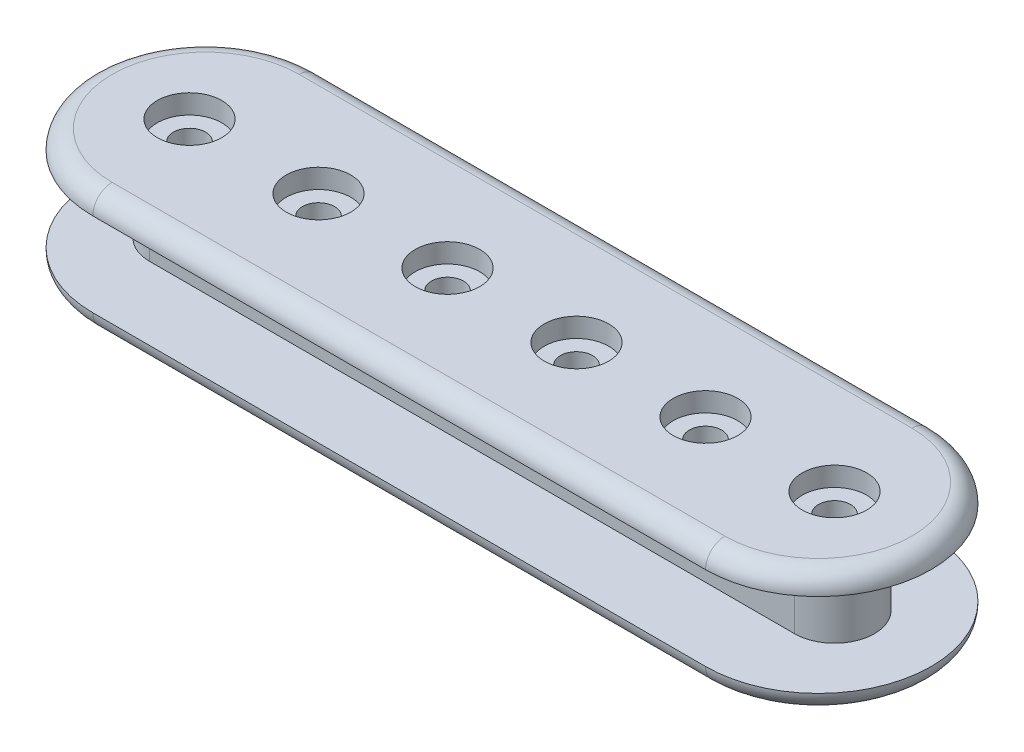
from build123d import *
from build123d.topology import SkipClean

# Parameters (mm, degrees)
BOSS_EXTRUDE1_DEPTH     = 1.524
SKETCH2_R               = 1.2700000000000011
BOSS_EXTRUDE2_DEPTH     = 6.603999999999999
BOSS_EXTRUDE3_DEPTH     = 1.524
FILLET1_R               = 1.524
CUT_EXTRUDE1_DEPTH      = 36.14849760658342
CUT_EXTRUDE1_DEPTH_BACK = 36.14849760658342
SKETCH2_3_R             = 1.2700000000000011
CUT_EXTRUDE2_DEPTH      = 36.53186744318402
CUT_EXTRUDE2_DEPTH_BACK = 1.524
SKETCH4_R               = 2.539999999999999


with BuildPart() as part:
    # Sketch1 → Boss-Extrude1 (new body)
    with BuildSketch(Plane(origin=(0, 0, 0), x_dir=(1, 0, 0), z_dir=(0, 1, 0))):
        with BuildLine():
            Line((24.13, -8.88999999999999), (-24.13, -8.889999999999995))
            ThreePointArc((-24.13, -8.889999999999995), (-33.019999999999996, 2.78e-15), (-24.130000000000003, 8.89))
            Line((-24.130000000000003, 8.89), (24.130000000000003, 8.890000000000006))
            ThreePointArc((24.130000000000003, 8.890000000000006), (33.02, 8.03e-15), (24.13, -8.88999999999999))
        make_face()
    extrude(amount=BOSS_EXTRUDE1_DEPTH)

    # Sketch2 → Boss-Extrude2 (add)
    # profile 1 of 35: a face of its own
    with BuildSketch(Plane(origin=(0, 1.524, 0), x_dir=(1, 0, 0), z_dir=(0, 1, 0))):
        with BuildLine():
            ThreePointArc((-22.64366109485788, 1.5239999999999858), (-23.80000160000079, 2.7129292803167524), (-25.399999999999995, 3.1495999999999986))
            ThreePointArc((-25.399999999999995, 3.1495999999999986), (-28.549599999999995, 3.9e-16), (-25.399999999999995, -3.1495999999999986))
            ThreePointArc((-25.399999999999995, -3.1495999999999986), (-23.80000160000079, -2.7129292803167524), (-22.64366109485788, -1.5239999999999856))
            Line((-22.643661094857876, -1.5239999999999954), (-25.4, -1.5239999999999954))
            Line((-25.4, -1.5239999999999954), (-25.4, -1.2700000000000011))
            ThreePointArc((-25.40000000000001, -1.2700000000000011), (-26.669999999999995, -9.7e-16), (-25.400000000000013, 1.2700000000000011))
            Line((-25.4, 1.2700000000000011), (-25.4, 1.5239999999999954))
            Line((-25.4, 1.5239999999999954), (-22.643661094857876, 1.5239999999999954))
        make_face()
    # profile 2 of 35: a face of its own
    with BuildSketch(Plane(origin=(0, 1.524, 0), x_dir=(1, 0, 0), z_dir=(0, 1, 0))):
        with BuildLine():
            ThreePointArc((-22.250399999999996, 0), (-22.350299590481413, 0.7869609724644511), (-22.64366109485788, 1.5239999999999858))
            Line((-22.643661094857876, 1.5239999999999954), (-25.4, 1.5239999999999954))
            Line((-25.4, 1.5239999999999954), (-25.4, 1.2700000000000011))
            ThreePointArc((-25.400000000000013, 1.2700000000000011), (-24.501974387893085, 0.8980256121069224), (-24.129999999999995, 0))
            ThreePointArc((-24.129999999999995, -3.1e-16), (-24.501974387893085, -0.898025612106922), (-25.40000000000001, -1.2700000000000011))
            Line((-25.4, -1.2700000000000011), (-25.4, -1.5239999999999954))
            Line((-25.4, -1.5239999999999954), (-22.643661094857876, -1.5239999999999954))
            ThreePointArc((-22.64366109485788, -1.5239999999999856), (-22.350299590481413, -0.7869609724644512), (-22.250399999999996, -7.7e-16))
        make_face()
    # profile 3 of 35: a face of its own
    with BuildSketch(Plane(origin=(0, 1.524, 0), x_dir=(1, 0, 0), z_dir=(0, 1, 0))):
        with BuildLine():
            Line((-15.239999999999851, 3.149599999999998), (-25.399999999999995, 3.149599999999998))
            ThreePointArc((-25.399999999999995, 3.1495999999999986), (-23.80000160000079, 2.7129292803167524), (-22.64366109485788, 1.5239999999999858))
            Line((-22.643661094857876, 1.5239999999999954), (-17.99633890514213, 1.5239999999999954))
            ThreePointArc((-17.99633890514212, 1.5239999999999714), (-16.839998399999146, 2.712929280316786), (-15.239999999999851, 3.1496000000000004))
        make_face()
    # profile 4 of 35: a face of its own
    with BuildSketch(Plane(origin=(0, 1.524, 0), x_dir=(1, 0, 0), z_dir=(0, 1, 0))):
        with BuildLine():
            Line((-17.99633890514213, 1.5239999999999954), (-22.643661094857876, 1.5239999999999954))
            ThreePointArc((-22.64366109485788, 1.5239999999999858), (-22.350299590481413, 0.7869609724644511), (-22.250399999999996, 0))
            ThreePointArc((-22.250399999999996, -7.7e-16), (-22.350299590481413, -0.7869609724644512), (-22.64366109485788, -1.5239999999999856))
            Line((-22.643661094857876, -1.5239999999999954), (-17.99633890514213, -1.5239999999999954))
            ThreePointArc((-17.99633890514212, -1.5239999999999694), (-18.389599999999994, 3.9e-16), (-17.99633890514212, 1.5239999999999714))
        make_face()
    # profile 5 of 35: a face of its own
    with BuildSketch(Plane(origin=(0, 1.524, 0), x_dir=(1, 0, 0), z_dir=(0, 1, 0))):
        with BuildLine():
            ThreePointArc((-22.64366109485788, 1.5239999999999858), (-23.80000160000079, 2.7129292803167524), (-25.399999999999995, 3.1495999999999986))
            ThreePointArc((-25.399999999999995, 3.1495999999999986), (-28.549599999999995, 3.9e-16), (-25.399999999999995, -3.1495999999999986))
            ThreePointArc((-25.399999999999995, -3.1495999999999986), (-23.80000160000079, -2.7129292803167524), (-22.64366109485788, -1.5239999999999856))
            Line((-22.643661094857876, -1.5239999999999954), (-25.4, -1.5239999999999954))
            Line((-25.4, -1.5239999999999954), (-25.4, -1.2700000000000011))
            ThreePointArc((-25.40000000000001, -1.2700000000000011), (-26.669999999999995, -9.7e-16), (-25.400000000000013, 1.2700000000000011))
            Line((-25.4, 1.2700000000000011), (-25.4, 1.5239999999999954))
            Line((-25.4, 1.5239999999999954), (-22.643661094857876, 1.5239999999999954))
        make_face()
    # profile 6 of 35: a face of its own
    with BuildSketch(Plane(origin=(0, 1.524, 0), x_dir=(1, 0, 0), z_dir=(0, 1, 0))):
        with BuildLine():
            ThreePointArc((-22.250399999999996, 0), (-22.350299590481413, 0.7869609724644511), (-22.64366109485788, 1.5239999999999858))
            Line((-22.643661094857876, 1.5239999999999954), (-25.4, 1.5239999999999954))
            Line((-25.4, 1.5239999999999954), (-25.4, 1.2700000000000011))
            ThreePointArc((-25.400000000000013, 1.2700000000000011), (-24.501974387893085, 0.8980256121069224), (-24.129999999999995, 0))
            ThreePointArc((-24.129999999999995, -3.1e-16), (-24.501974387893085, -0.898025612106922), (-25.40000000000001, -1.2700000000000011))
            Line((-25.4, -1.2700000000000011), (-25.4, -1.5239999999999954))
            Line((-25.4, -1.5239999999999954), (-22.643661094857876, -1.5239999999999954))
            ThreePointArc((-22.64366109485788, -1.5239999999999856), (-22.350299590481413, -0.7869609724644512), (-22.250399999999996, -7.7e-16))
        make_face()
    # profile 7 of 35: a face of its own
    with BuildSketch(Plane(origin=(0, 1.524, 0), x_dir=(1, 0, 0), z_dir=(0, 1, 0))):
        with BuildLine():
            ThreePointArc((-22.64366109485788, -1.5239999999999856), (-23.80000160000079, -2.7129292803167524), (-25.399999999999995, -3.1495999999999986))
            Line((-25.399999999999995, -3.149599999999998), (-15.239999999999842, -3.149599999999998))
            ThreePointArc((-15.239999999999844, -3.1496000000000004), (-16.839998399999146, -2.7129292803167875), (-17.99633890514212, -1.5239999999999694))
            Line((-17.99633890514213, -1.5239999999999954), (-22.643661094857876, -1.5239999999999954))
        make_face()
    # profile 8 of 35: a face of its own
    with BuildSketch(Plane(origin=(0, 1.524, 0), x_dir=(1, 0, 0), z_dir=(0, 1, 0))):
        with BuildLine():
            ThreePointArc((-17.99633890514212, -1.5239999999999694), (-16.839998399999146, -2.7129292803167875), (-15.239999999999844, -3.1496000000000004))
            ThreePointArc((-15.239999999999844, -3.1496000000000004), (-13.640001600000728, -2.7129292803167186), (-12.483661094857885, -1.5239999999999987))
            Line((-12.483661094857887, -1.5239999999999954), (-17.99633890514213, -1.5239999999999954))
        make_face()
    # profile 9 of 35: a face of its own
    with BuildSketch(Plane(origin=(0, 1.524, 0), x_dir=(1, 0, 0), z_dir=(0, 1, 0))):
        with BuildLine():
            ThreePointArc((-12.090399999999995, 0), (-12.190299590481414, 0.7869609724644582), (-12.483661094857885, 1.523999999999999))
            Line((-12.483661094857887, 1.5239999999999954), (-17.99633890514213, 1.5239999999999954))
            ThreePointArc((-17.99633890514212, 1.5239999999999714), (-18.389599999999994, 3.9e-16), (-17.99633890514212, -1.5239999999999694))
            Line((-17.99633890514213, -1.5239999999999954), (-12.483661094857887, -1.5239999999999954))
            ThreePointArc((-12.483661094857885, -1.5239999999999987), (-12.190299590481414, -0.7869609724644571), (-12.090399999999995, -7.7e-16))
        make_face()
        with Locations(Location((-15.239999999999995, 0, 0), (0, 0, 90))):
            Circle(SKETCH2_R, mode=Mode.SUBTRACT)
    # profile 10 of 35: a face of its own
    with BuildSketch(Plane(origin=(0, 1.524, 0), x_dir=(1, 0, 0), z_dir=(0, 1, 0))):
        with BuildLine():
            ThreePointArc((-12.483661094857885, 1.523999999999999), (-13.640001600000732, 2.712929280316721), (-15.239999999999853, 3.1496000000000004))
            ThreePointArc((-15.239999999999851, 3.1496000000000004), (-16.839998399999146, 2.712929280316786), (-17.99633890514212, 1.5239999999999714))
            Line((-17.99633890514213, 1.5239999999999954), (-12.483661094857887, 1.5239999999999954))
        make_face()
    # profile 11 of 35: a face of its own
    with BuildSketch(Plane(origin=(0, 1.524, 0), x_dir=(1, 0, 0), z_dir=(0, 1, 0))):
        with BuildLine():
            Line((-5.080000024231023, 3.149599999999998), (-15.239999999999851, 3.149599999999998))
            ThreePointArc((-15.239999999999853, 3.1496000000000004), (-13.640001600000732, 2.712929280316721), (-12.483661094857885, 1.523999999999999))
            Line((-12.483661094857887, 1.5239999999999954), (-7.836338905142128, 1.5239999999999954))
            ThreePointArc((-7.836338905142118, 1.5239999999999725), (-6.679998410434988, 2.712929274162062), (-5.0800000242310235, 3.1496))
        make_face()
    # profile 12 of 35: a face of its own
    with BuildSketch(Plane(origin=(0, 1.524, 0), x_dir=(1, 0, 0), z_dir=(0, 1, 0))):
        with BuildLine():
            Line((-7.836338905142128, 1.5239999999999954), (-12.483661094857887, 1.5239999999999954))
            ThreePointArc((-12.483661094857885, 1.523999999999999), (-12.190299590481414, 0.7869609724644582), (-12.090399999999995, 0))
            ThreePointArc((-12.090399999999995, -7.7e-16), (-12.190299590481414, -0.7869609724644571), (-12.483661094857885, -1.5239999999999987))
            Line((-12.483661094857887, -1.5239999999999954), (-7.836338905142128, -1.5239999999999954))
            ThreePointArc((-7.836338905142119, -1.5239999999999716), (-8.229599999999994, 3.9e-16), (-7.836338905142118, 1.5239999999999725))
        make_face()
    # profile 13 of 35: a face of its own
    with BuildSketch(Plane(origin=(0, 1.524, 0), x_dir=(1, 0, 0), z_dir=(0, 1, 0))):
        with BuildLine():
            ThreePointArc((-12.483661094857885, -1.5239999999999987), (-13.640001600000728, -2.7129292803167186), (-15.239999999999844, -3.1496000000000004))
            Line((-15.239999999999842, -3.149599999999998), (-5.080000009255329, -3.149599999999998))
            ThreePointArc((-5.080000009255329, -3.1496), (-6.67999840398528, -2.712929277965892), (-7.836338905142119, -1.5239999999999716))
            Line((-7.836338905142128, -1.5239999999999954), (-12.483661094857887, -1.5239999999999954))
        make_face()
    # profile 14 of 35: a face of its own
    with BuildSketch(Plane(origin=(0, 1.524, 0), x_dir=(1, 0, 0), z_dir=(0, 1, 0))):
        with BuildLine():
            ThreePointArc((-7.836338905142119, -1.5239999999999716), (-6.67999840398528, -2.712929277965892), (-5.080000009255329, -3.1496))
            ThreePointArc((-5.080000009255329, -3.1496), (-3.480001603986866, -2.7129292826676146), (-2.323661094857884, -1.5239999999999985))
            Line((-2.323661094857883, -1.5239999999999954), (-7.836338905142128, -1.5239999999999954))
        make_face()
    # profile 15 of 35: a face of its own
    with BuildSketch(Plane(origin=(0, 1.524, 0), x_dir=(1, 0, 0), z_dir=(0, 1, 0))):
        with BuildLine():
            ThreePointArc((-1.930399999999994, 0), (-2.030299590481414, 0.7869609724644581), (-2.323661094857884, 1.5239999999999987))
            Line((-2.3236610948578864, 1.5239999999999954), (-7.836338905142128, 1.5239999999999954))
            ThreePointArc((-7.836338905142118, 1.5239999999999725), (-8.229599999999994, 3.9e-16), (-7.836338905142119, -1.5239999999999716))
            Line((-7.836338905142128, -1.5239999999999954), (-2.323661094857883, -1.5239999999999954))
            ThreePointArc((-2.323661094857884, -1.5239999999999985), (-2.030299590481414, -0.786960972464457), (-1.930399999999994, -7.7e-16))
        make_face()
        with Locations(Location((-5.079999999999994, 0, 0), (0, 0, 90))):
            Circle(SKETCH2_R, mode=Mode.SUBTRACT)
    # profile 16 of 35: a face of its own
    with BuildSketch(Plane(origin=(0, 1.524, 0), x_dir=(1, 0, 0), z_dir=(0, 1, 0))):
        with BuildLine():
            ThreePointArc((-2.323661094857884, 1.5239999999999987), (-3.480001610436574, 2.7129292864714447), (-5.0800000242310235, 3.1496))
            ThreePointArc((-5.0800000242310235, 3.1496), (-6.679998410434988, 2.712929274162062), (-7.836338905142118, 1.5239999999999725))
            Line((-7.836338905142128, 1.5239999999999954), (-2.3236610948578864, 1.5239999999999954))
        make_face()
    # profile 17 of 35: a face of its own
    with BuildSketch(Plane(origin=(0, 1.524, 0), x_dir=(1, 0, 0), z_dir=(0, 1, 0))):
        with BuildLine():
            Line((5.079999990744664, 3.149599999999998), (-5.080000024231023, 3.149599999999998))
            ThreePointArc((-5.0800000242310235, 3.1496), (-3.480001610436574, 2.7129292864714447), (-2.323661094857884, 1.5239999999999987))
            Line((-2.3236610948578864, 1.5239999999999954), (2.3236610948578758, 1.5239999999999954))
            ThreePointArc((2.323661094857882, 1.523999999999973), (3.4800015960147173, 2.71292927796589), (5.079999990744665, 3.1495999999999986))
        make_face()
    # profile 18 of 35: a face of its own
    with BuildSketch(Plane(origin=(0, 1.524, 0), x_dir=(1, 0, 0), z_dir=(0, 1, 0))):
        with BuildLine():
            Line((2.3236610948578758, 1.5239999999999954), (-2.3236610948578864, 1.5239999999999954))
            ThreePointArc((-2.323661094857884, 1.5239999999999987), (-2.030299590481414, 0.7869609724644581), (-1.930399999999994, 0))
            ThreePointArc((-1.930399999999994, -7.7e-16), (-2.030299590481414, -0.786960972464457), (-2.323661094857884, -1.5239999999999985))
            Line((-2.323661094857883, -1.5239999999999954), (2.323661094857872, -1.5239999999999954))
            ThreePointArc((2.3236610948578815, -1.5239999999999723), (1.930400000000006, 3.9e-16), (2.323661094857882, 1.523999999999973))
        make_face()
    # profile 19 of 35: a face of its own
    with BuildSketch(Plane(origin=(0, 1.524, 0), x_dir=(1, 0, 0), z_dir=(0, 1, 0))):
        with BuildLine():
            ThreePointArc((-2.323661094857884, -1.5239999999999985), (-3.480001603986866, -2.7129292826676146), (-5.080000009255329, -3.1496))
            Line((-5.080000009255329, -3.149599999999998), (5.079999980654623, -3.149599999999998))
            ThreePointArc((5.079999980654621, -3.1495999999999986), (3.4800015916691547, -2.712929275403017), (2.3236610948578815, -1.5239999999999723))
            Line((2.323661094857872, -1.5239999999999954), (-2.323661094857883, -1.5239999999999954))
        make_face()
    # profile 20 of 35: a face of its own
    with BuildSketch(Plane(origin=(0, 1.524, 0), x_dir=(1, 0, 0), z_dir=(0, 1, 0))):
        with BuildLine():
            ThreePointArc((2.3236610948578815, -1.5239999999999723), (3.4800015916691547, -2.712929275403017), (5.079999980654621, -3.1495999999999986))
            ThreePointArc((5.079999980654621, -3.1495999999999986), (6.679998391667567, -2.7129292852304876), (7.836338905142113, -1.5239999999999978))
            Line((7.836338905142114, -1.5239999999999954), (2.323661094857872, -1.5239999999999954))
        make_face()
    # profile 21 of 35: a face of its own
    with BuildSketch(Plane(origin=(0, 1.524, 0), x_dir=(1, 0, 0), z_dir=(0, 1, 0))):
        with BuildLine():
            ThreePointArc((8.229600000000003, 0), (8.129700409518584, 0.7869609724644577), (7.836338905142113, 1.523999999999998))
            Line((7.836338905142114, 1.5239999999999954), (2.3236610948578758, 1.5239999999999954))
            ThreePointArc((2.323661094857882, 1.523999999999973), (1.930400000000006, 3.9e-16), (2.3236610948578815, -1.5239999999999723))
            Line((2.323661094857872, -1.5239999999999954), (7.836338905142114, -1.5239999999999954))
            ThreePointArc((7.836338905142113, -1.5239999999999978), (8.129700409518584, -0.7869609724644566), (8.229600000000003, -7.7e-16))
        make_face()
        with Locations(Location((5.0800000000000045, 0, 0), (0, 0, 90))):
            Circle(SKETCH2_R, mode=Mode.SUBTRACT)
    # profile 22 of 35: a face of its own
    with BuildSketch(Plane(origin=(0, 1.524, 0), x_dir=(1, 0, 0), z_dir=(0, 1, 0))):
        with BuildLine():
            ThreePointArc((7.836338905142113, 1.523999999999998), (6.67999839601313, 2.7129292826676146), (5.079999990744664, 3.1495999999999986))
            ThreePointArc((5.079999990744665, 3.1495999999999986), (3.4800015960147173, 2.71292927796589), (2.323661094857882, 1.523999999999973))
            Line((2.3236610948578758, 1.5239999999999954), (7.836338905142114, 1.5239999999999954))
        make_face()
    # profile 23 of 35: a face of its own
    with BuildSketch(Plane(origin=(0, 1.524, 0), x_dir=(1, 0, 0), z_dir=(0, 1, 0))):
        with BuildLine():
            Line((15.240000006751938, 3.149599999999998), (5.079999990744664, 3.149599999999998))
            ThreePointArc((5.079999990744664, 3.1495999999999986), (6.67999839601313, 2.7129292826676146), (7.836338905142113, 1.523999999999998))
            Line((7.836338905142114, 1.5239999999999954), (12.483661094857876, 1.5239999999999954))
            ThreePointArc((12.483661094857885, 1.523999999999973), (13.640001602908706, 2.7129292820317406), (15.240000006751936, 3.1495999999999986))
        make_face()
    # profile 24 of 35: a face of its own
    with BuildSketch(Plane(origin=(0, 1.524, 0), x_dir=(1, 0, 0), z_dir=(0, 1, 0))):
        with BuildLine():
            Line((12.483661094857876, 1.5239999999999954), (7.836338905142114, 1.5239999999999954))
            ThreePointArc((7.836338905142113, 1.523999999999998), (8.129700409518584, 0.7869609724644577), (8.229600000000003, 0))
            ThreePointArc((8.229600000000003, -7.7e-16), (8.129700409518584, -0.7869609724644566), (7.836338905142113, -1.5239999999999978))
            Line((7.836338905142114, -1.5239999999999954), (12.483661094857876, -1.5239999999999954))
            ThreePointArc((12.483661094857885, -1.5239999999999723), (12.09040000000001, 3.9e-16), (12.483661094857885, 1.523999999999973))
        make_face()
    # profile 25 of 35: a face of its own
    with BuildSketch(Plane(origin=(0, 1.524, 0), x_dir=(1, 0, 0), z_dir=(0, 1, 0))):
        with BuildLine():
            ThreePointArc((7.836338905142113, -1.5239999999999978), (6.679998391667567, -2.7129292852304876), (5.079999980654621, -3.1495999999999986))
            Line((5.079999980654623, -3.149599999999998), (15.240000000000155, -3.149599999999998))
            ThreePointArc((15.240000000000155, -3.1495999999999986), (13.640001600000858, -2.712929280316786), (12.483661094857885, -1.5239999999999723))
            Line((12.483661094857876, -1.5239999999999954), (7.836338905142114, -1.5239999999999954))
        make_face()
    # profile 26 of 35: a face of its own
    with BuildSketch(Plane(origin=(0, 1.524, 0), x_dir=(1, 0, 0), z_dir=(0, 1, 0))):
        with BuildLine():
            ThreePointArc((12.483661094857885, -1.5239999999999723), (13.640001600000858, -2.712929280316786), (15.240000000000155, -3.1495999999999986))
            ThreePointArc((15.240000000000155, -3.1495999999999986), (16.83999839999927, -2.712929280316718), (17.996338905142117, -1.5239999999999978))
            Line((17.996338905142117, -1.5239999999999954), (12.483661094857876, -1.5239999999999954))
        make_face()
    # profile 27 of 35: a face of its own
    with BuildSketch(Plane(origin=(0, 1.524, 0), x_dir=(1, 0, 0), z_dir=(0, 1, 0))):
        with BuildLine():
            ThreePointArc((18.389600000000005, 0), (18.289700409518588, 0.7869609724644582), (17.996338905142117, 1.5239999999999987))
            Line((17.996338905142114, 1.5239999999999954), (12.483661094857876, 1.5239999999999954))
            ThreePointArc((12.483661094857885, 1.523999999999973), (12.09040000000001, 3.9e-16), (12.483661094857885, -1.5239999999999723))
            Line((12.483661094857876, -1.5239999999999954), (17.996338905142117, -1.5239999999999954))
            ThreePointArc((17.996338905142117, -1.5239999999999978), (18.289700409518588, -0.7869609724644566), (18.389600000000005, -7.7e-16))
        make_face()
        with Locations(Location((15.240000000000007, 0, 0), (0, 0, 90))):
            Circle(SKETCH2_R, mode=Mode.SUBTRACT)
    # profile 28 of 35: a face of its own
    with BuildSketch(Plane(origin=(0, 1.524, 0), x_dir=(1, 0, 0), z_dir=(0, 1, 0))):
        with BuildLine():
            ThreePointArc((17.996338905142117, 1.5239999999999987), (16.839998402907117, 2.7129292786017642), (15.240000006751936, 3.1495999999999986))
            ThreePointArc((15.240000006751936, 3.1495999999999986), (13.640001602908706, 2.7129292820317406), (12.483661094857885, 1.523999999999973))
            Line((12.483661094857876, 1.5239999999999954), (17.996338905142114, 1.5239999999999954))
        make_face()
    # profile 29 of 35: a face of its own
    with BuildSketch(Plane(origin=(0, 1.524, 0), x_dir=(1, 0, 0), z_dir=(0, 1, 0))):
        with BuildLine():
            Line((25.40000000000001, 3.149599999999998), (15.240000006751938, 3.149599999999998))
            ThreePointArc((15.240000006751936, 3.1495999999999986), (16.839998402907117, 2.7129292786017642), (17.996338905142117, 1.5239999999999987))
            Line((17.996338905142114, 1.5239999999999954), (22.643661094857876, 1.5239999999999954))
            ThreePointArc((22.643661094857883, 1.5239999999999694), (23.800001600000797, 2.712929280316748), (25.40000000000001, 3.1495999999999986))
        make_face()
    # profile 30 of 35: a face of its own
    with BuildSketch(Plane(origin=(0, 1.524, 0), x_dir=(1, 0, 0), z_dir=(0, 1, 0))):
        with BuildLine():
            ThreePointArc((17.996338905142117, -1.5239999999999978), (16.83999839999927, -2.712929280316718), (15.240000000000155, -3.1495999999999986))
            Line((15.240000000000155, -3.149599999999998), (25.40000000000001, -3.149599999999998))
            ThreePointArc((25.40000000000001, -3.1495999999999986), (23.800001600000794, -2.7129292803167475), (22.643661094857883, -1.5239999999999687))
            Line((22.643661094857876, -1.5239999999999954), (17.996338905142117, -1.5239999999999954))
        make_face()
    # profile 31 of 35: a face of its own
    with BuildSketch(Plane(origin=(0, 1.524, 0), x_dir=(1, 0, 0), z_dir=(0, 1, 0))):
        with BuildLine():
            Line((22.643661094857876, 1.5239999999999954), (17.996338905142114, 1.5239999999999954))
            ThreePointArc((17.996338905142117, 1.5239999999999987), (18.289700409518588, 0.7869609724644582), (18.389600000000005, 0))
            ThreePointArc((18.389600000000005, -7.7e-16), (18.289700409518588, -0.7869609724644566), (17.996338905142117, -1.5239999999999978))
            Line((17.996338905142117, -1.5239999999999954), (22.643661094857876, -1.5239999999999954))
            ThreePointArc((22.643661094857883, -1.5239999999999687), (22.25040000000001, 3.9e-16), (22.643661094857883, 1.5239999999999694))
        make_face()
    # profile 32 of 35: a face of its own
    with BuildSketch(Plane(origin=(0, 1.524, 0), x_dir=(1, 0, 0), z_dir=(0, 1, 0))):
        with BuildLine():
            ThreePointArc((28.54960000000001, 0), (27.62710351802516, 2.227103518025149), (25.40000000000001, 3.1495999999999986))
            ThreePointArc((25.40000000000001, 3.1495999999999986), (23.800001600000797, 2.712929280316748), (22.643661094857883, 1.5239999999999694))
            Line((22.643661094857876, 1.5239999999999954), (25.4, 1.5239999999999954))
            Line((25.4, 1.5239999999999954), (25.4, 1.2700000000000011))
            ThreePointArc((25.399999999999984, 1.2700000000000011), (26.298025612106915, 0.898025612106925), (26.67000000000001, 0))
            ThreePointArc((26.67000000000001, -3.1e-16), (26.298025612106915, -0.8980256121069251), (25.399999999999984, -1.2700000000000011))
            Line((25.4, -1.2700000000000011), (25.4, -1.5239999999999954))
            Line((25.4, -1.5239999999999954), (22.643661094857876, -1.5239999999999954))
            ThreePointArc((22.643661094857883, -1.5239999999999687), (23.800001600000794, -2.7129292803167475), (25.40000000000001, -3.1495999999999986))
            ThreePointArc((25.40000000000001, -3.1495999999999986), (27.62710351802516, -2.2271035180251495), (28.54960000000001, -7.7e-16))
        make_face()
    # profile 33 of 35: a face of its own
    with BuildSketch(Plane(origin=(0, 1.524, 0), x_dir=(1, 0, 0), z_dir=(0, 1, 0))):
        with BuildLine():
            Line((25.4, 1.5239999999999954), (22.643661094857876, 1.5239999999999954))
            ThreePointArc((22.643661094857883, 1.5239999999999694), (22.25040000000001, 3.9e-16), (22.643661094857883, -1.5239999999999687))
            Line((22.643661094857876, -1.5239999999999954), (25.4, -1.5239999999999954))
            Line((25.4, -1.5239999999999954), (25.4, -1.2700000000000011))
            ThreePointArc((25.399999999999984, -1.2700000000000011), (24.13000000000001, 1.6e-16), (25.399999999999984, 1.2700000000000011))
            Line((25.4, 1.2700000000000011), (25.4, 1.5239999999999954))
        make_face()
    # profile 34 of 35: a face of its own
    with BuildSketch(Plane(origin=(0, 1.524, 0), x_dir=(1, 0, 0), z_dir=(0, 1, 0))):
        with BuildLine():
            ThreePointArc((28.54960000000001, 0), (27.62710351802516, 2.227103518025149), (25.40000000000001, 3.1495999999999986))
            ThreePointArc((25.40000000000001, 3.1495999999999986), (23.800001600000797, 2.712929280316748), (22.643661094857883, 1.5239999999999694))
            Line((22.643661094857876, 1.5239999999999954), (25.4, 1.5239999999999954))
            Line((25.4, 1.5239999999999954), (25.4, 1.2700000000000011))
            ThreePointArc((25.399999999999984, 1.2700000000000011), (26.298025612106915, 0.898025612106925), (26.67000000000001, 0))
            ThreePointArc((26.67000000000001, -3.1e-16), (26.298025612106915, -0.8980256121069251), (25.399999999999984, -1.2700000000000011))
            Line((25.4, -1.2700000000000011), (25.4, -1.5239999999999954))
            Line((25.4, -1.5239999999999954), (22.643661094857876, -1.5239999999999954))
            ThreePointArc((22.643661094857883, -1.5239999999999687), (23.800001600000794, -2.7129292803167475), (25.40000000000001, -3.1495999999999986))
            ThreePointArc((25.40000000000001, -3.1495999999999986), (27.62710351802516, -2.2271035180251495), (28.54960000000001, -7.7e-16))
        make_face()
    # profile 35 of 35: a face of its own
    with BuildSketch(Plane(origin=(0, 1.524, 0), x_dir=(1, 0, 0), z_dir=(0, 1, 0))):
        with BuildLine():
            Line((25.4, 1.5239999999999954), (22.643661094857876, 1.5239999999999954))
            ThreePointArc((22.643661094857883, 1.5239999999999694), (22.25040000000001, 3.9e-16), (22.643661094857883, -1.5239999999999687))
            Line((22.643661094857876, -1.5239999999999954), (25.4, -1.5239999999999954))
            Line((25.4, -1.5239999999999954), (25.4, -1.2700000000000011))
            ThreePointArc((25.399999999999984, -1.2700000000000011), (24.13000000000001, 1.6e-16), (25.399999999999984, 1.2700000000000011))
            Line((25.4, 1.2700000000000011), (25.4, 1.5239999999999954))
        make_face()
    extrude(amount=BOSS_EXTRUDE2_DEPTH)

    # Sketch3 → Boss-Extrude3 (add)
    with BuildSketch(Plane(origin=(0, 8.128, 0), x_dir=(1, 0, 0), z_dir=(0, 1, 0))):
        with BuildLine():
            Line((-24.13, -8.889999999999995), (24.13, -8.88999999999999))
            ThreePointArc((24.13, -8.88999999999999), (33.02, 8.03e-15), (24.130000000000003, 8.890000000000006))
            Line((24.130000000000003, 8.890000000000006), (-24.130000000000003, 8.89))
            ThreePointArc((-24.130000000000003, 8.89), (-33.019999999999996, 2.78e-15), (-24.13, -8.889999999999995))
        make_face()
    extrude(amount=BOSS_EXTRUDE3_DEPTH)

    # Fillet1
    fillet1_edges = [part.edges().sort_by_distance(p)[0] for p in [
        (33.02, 0, -6.61e-15),
        (0, 0, -8.890000000000004),
        (0, 0, 8.889999999999993),
        (-33.019999999999996, 0, 6.9e-16),
        (33.02, 9.652000000000001, -6.71e-15),
        (0, 9.652000000000001, 8.889999999999993),
        (0, 9.652000000000001, -8.890000000000004),
        (-33.019999999999996, 9.652000000000001, -1.58e-15),
    ]]
    fillet(fillet1_edges, radius=FILLET1_R - 0.0001)  # a hair under: the kernel refuses the full size

    # Sketch2<3> → Cut-Extrude1 (cut, two sides: drawn at the far end of the back side and taken through both)
    with SkipClean():  # the faces are left unmerged after this step: merging them gives an invalid solid
        with BuildSketch(Plane(origin=(0, 1.524, 0), x_dir=(1, 0, 0), z_dir=(0, 1, 0)).offset(-CUT_EXTRUDE1_DEPTH_BACK)):
            with Locations(Location((-25.399999999999995, 0, 0), (0, 0, 90))):
                Circle(SKETCH2_3_R)
            with Locations(Location((-15.239999999999995, 0, 0), (0, 0, 90))):
                Circle(SKETCH2_3_R)
            with Locations(Location((-5.079999999999994, 0, 0), (0, 0, 90))):
                Circle(SKETCH2_3_R)
            with Locations(Location((5.0800000000000045, 0, 0), (0, 0, 90))):
                Circle(SKETCH2_3_R)
            with Locations(Location((15.240000000000007, 0, 0), (0, 0, 90))):
                Circle(SKETCH2_3_R)
            with Locations(Location((25.40000000000001, 0, 0), (0, 0, 90))):
                Circle(SKETCH2_3_R)
        extrude(amount=CUT_EXTRUDE1_DEPTH + CUT_EXTRUDE1_DEPTH_BACK, mode=Mode.SUBTRACT)

    # Sketch4 → Cut-Extrude2 (cut, two sides: drawn at the far end of the back side and taken through both)
    with BuildSketch(Plane(origin=(0, 9.652, 0), x_dir=(1, 0, 0), z_dir=(0, 1, 0)).offset(-CUT_EXTRUDE2_DEPTH_BACK)):
        with Locations(Location((-25.399999999999995, 0, 0), (0, 0, 270))):
            Circle(SKETCH4_R)
        with Locations(Location((-15.239999999999995, 0, 0), (0, 0, 270))):
            Circle(SKETCH4_R)
        with Locations(Location((-5.079999999999994, 0, 0), (0, 0, 270))):
            Circle(SKETCH4_R)
        with Locations(Location((5.0800000000000045, 0, 0), (0, 0, 270))):
            Circle(SKETCH4_R)
        with Locations(Location((15.240000000000007, 0, 0), (0, 0, 270))):
            Circle(SKETCH4_R)
        with Locations(Location((25.40000000000001, 0, 0), (0, 0, 270))):
            Circle(SKETCH4_R)
    extrude(amount=CUT_EXTRUDE2_DEPTH + CUT_EXTRUDE2_DEPTH_BACK, mode=Mode.SUBTRACT)


solid = part.part
